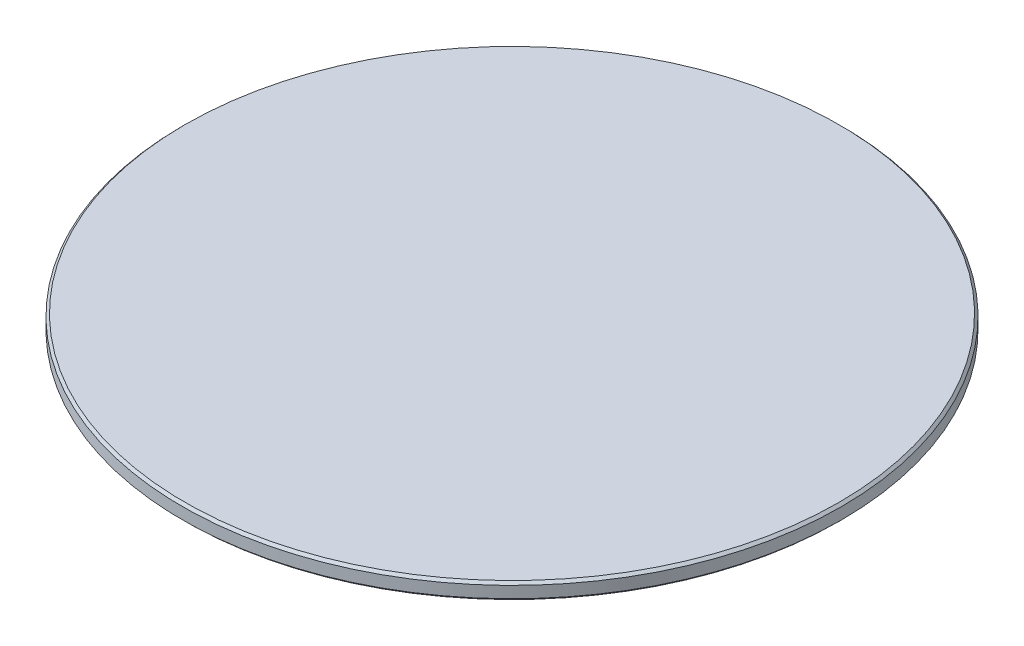
from build123d import *


with BuildPart() as part:
    # Esquisse1 → Révolution1 (revolve)
    with BuildSketch(Plane.XY):
        Polygon((0, 0), (19.85, 0), (20, 0.15), (20, 0.85), (19.85, 1), (0, 1), align=None)
    revolve(axis=Axis((0, 1, 0), (0, -1, 0)))


solid = part.part
